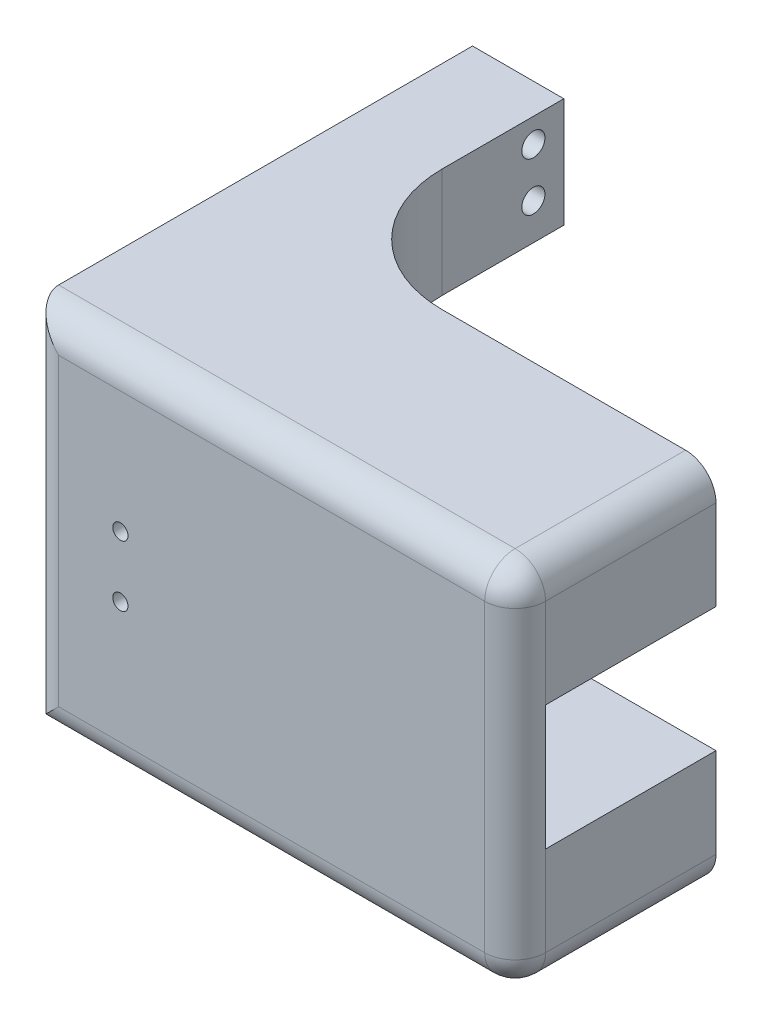
from build123d import *

# Parameters (mm, degrees)
SKETCH_2_W          = 80
SKETCH_2_H          = 60
EXTRUDE_2_DEPTH     = 33
SKETCH_3_W          = 40.7
SKETCH_3_H          = 20.5
CUT_EXTRUDE_1_DEPTH = 28
SKETCH_4_W          = 19.65
SKETCH_4_H          = 20.5
EXTRUDE_3_DEPTH     = 28
SKETCH_5_W          = 19.65
SKETCH_5_H          = 20.5
CUT_EXTRUDE_4_DEPTH = 28
SKETCH_10_W         = 15
SKETCH_10_H         = 18
EXTRUDE_6_DEPTH     = 40
M3X0_5_1_D          = 2.5
FILLET_2_R          = 20
FILLET_START        = -41
FILLET_7_DEPTH      = 81
FILLET_START_2      = -31
FILLET_7_2_DEPTH    = 62
FILLET_8_R          = 5
FILLET_10_R         = 1
M3X0_5_2_D          = 2.5
SKETCH_15_R         = 1.9
CUT_EXTRUDE_7_DEPTH = 65.031242484


with BuildPart() as part:
    # ｽｹｯﾁ2 → ﾎﾞｽ - 押し出し2 (new body)
    with BuildSketch(Plane.XY):
        Rectangle(SKETCH_2_W, SKETCH_2_H)
    extrude(amount=EXTRUDE_2_DEPTH)

    # ｽｹｯﾁ3 → ｶｯﾄ - 押し出し1 (cut)
    with BuildSketch(Plane.XY):
        Rectangle(SKETCH_3_W, SKETCH_3_H)
    extrude(amount=CUT_EXTRUDE_1_DEPTH, mode=Mode.SUBTRACT)

    # ｽｹｯﾁ4 → ﾎﾞｽ - 押し出し3 (add)
    with BuildSketch(Plane.XY):
        with Locations((30.175, 0)):
            Rectangle(SKETCH_4_W, SKETCH_4_H)
    extrude(amount=EXTRUDE_3_DEPTH)

    # ｽｹｯﾁ5 → ｶｯﾄ - 押し出し4 (cut)
    with BuildSketch(Plane.XY):
        with Locations((30.175, 0)):
            Rectangle(SKETCH_5_W, SKETCH_5_H)
    extrude(amount=CUT_EXTRUDE_4_DEPTH, mode=Mode.SUBTRACT)

    # ｽｹｯﾁ10 → ﾎﾞｽ - 押し出し6 (add)
    with BuildSketch(Plane.XY):
        with Locations((-32.5, 21)):
            Rectangle(SKETCH_10_W, SKETCH_10_H)
        with Locations((-32.5, -21)):
            Rectangle(SKETCH_10_W, SKETCH_10_H)
    extrude(amount=-EXTRUDE_6_DEPTH)

    # M3x0.5 ねじ穴1 (through all)
    with Locations(Plane(origin=(-25, 0, 0), x_dir=(0, 0, -1), z_dir=(1, 0, 0))):
        with Locations((35, 18), (35, -18), (35, 26), (35, -26)):
            Hole(M3X0_5_1_D / 2)

    # ﾌｨﾚｯﾄ2
    fillet_2_edges = [part.edges().sort_by_distance(p)[0] for p in [
        (-25, 21, 0),
        (-25, -21, 0),
    ]]
    fillet(fillet_2_edges, radius=FILLET_2_R)

    # ﾌｨﾚｯﾄ7: read off the stored shape, not the designer's step
    # ﾌｨﾚｯﾄ7 outline → ﾌｨﾚｯﾄ7 (cut)
    with BuildSketch(Plane.YZ.offset(FILLET_START)):
        with BuildLine():
            ThreePointArc((-30, 28), (-28.535533906, 31.535533906), (-25, 33))
            Line((-25, 33), (-30, 33))
            Line((-30, 33), (-30, 28))
        make_face()
        with BuildLine():
            ThreePointArc((25, 33), (28.535533906, 31.535533906), (30, 28))
            Line((30, 28), (30, 33))
            Line((30, 33), (25, 33))
        make_face()
    extrude(amount=FILLET_7_DEPTH, mode=Mode.SUBTRACT)

    # Fillet 7 2 outline → Fillet 7 2 (cut)
    with BuildSketch(Plane(origin=(0, 0, 0), x_dir=(1, 0, 0), z_dir=(0, 1, 0)).offset(FILLET_START_2)):
        with BuildLine():
            ThreePointArc((40, -28), (38.535533906, -31.535533906), (35, -33))
            Line((35, -33), (40, -33))
            Line((40, -33), (40, -28))
        make_face()
        with BuildLine():
            ThreePointArc((-35, -33), (-38.535533906, -31.535533906), (-40, -28))
            Line((-40, -28), (-40, -33))
            Line((-40, -33), (-35, -33))
        make_face()
    extrude(amount=FILLET_7_2_DEPTH, mode=Mode.SUBTRACT)

    # ﾌｨﾚｯﾄ8
    # the kernel refuses this fillet: 5 mm, written as the material it takes off along each edge
    with BuildSketch(Plane(origin=(35, 25, 28), x_dir=(1, 0, 0), z_dir=(0, 1, 0))) as fillet_8_piece_1_section:
        Polygon((0, 0), (FILLET_8_R, 0), (FILLET_8_R, -FILLET_8_R), (0, -FILLET_8_R), align=None)
    fillet_8_piece_1 = extrude(amount=FILLET_8_R, mode=Mode.PRIVATE)
    fillet_8_piece_1 = fillet_8_piece_1 - Plane(origin=(35, 25, 28), x_dir=(-0.7071067811865475, 0, -0.7071067811865475), z_dir=(0, 1, 0)) * Sphere(FILLET_8_R, mode=Mode.PRIVATE)
    add(fillet_8_piece_1, mode=Mode.SUBTRACT)
    with BuildSketch(Plane(origin=(35, -25, 28), x_dir=(0, -1, 0), z_dir=(1, 0, 0))) as fillet_8_piece_2_section:
        Polygon((0, 0), (FILLET_8_R, 0), (FILLET_8_R, -FILLET_8_R), (0, -FILLET_8_R), align=None)
    fillet_8_piece_2 = extrude(amount=FILLET_8_R, mode=Mode.PRIVATE)
    fillet_8_piece_2 = fillet_8_piece_2 - Plane(origin=(35, -25, 28), x_dir=(0, 0.7071067811865475, -0.7071067811865475), z_dir=(1, 0, 0)) * Sphere(FILLET_8_R, mode=Mode.PRIVATE)
    add(fillet_8_piece_2, mode=Mode.SUBTRACT)
    with BuildSketch(Plane(origin=(40, -30, -12.5), x_dir=(0, 1, 0), z_dir=(0, 0, 1)), Plane(origin=(40, 30, -12.5), x_dir=(-1, 0, 0), z_dir=(0, 0, 1))) as fillet_8_piece_3:
        with BuildLine():
            CenterArc((FILLET_8_R, FILLET_8_R), FILLET_8_R, 180, 90)
            Line((0, FILLET_8_R), (0, 0))
            Line((0, 0), (FILLET_8_R, 0))
        make_face()
    extrude(amount=40.5, mode=Mode.SUBTRACT)

    # ﾌｨﾚｯﾄ10
    fillet_10_edges = [part.edges().sort_by_distance(p)[0] for p in [
        (-22.5, 12, 0),
        (-22.5, -12, 0),
    ]]
    fillet(fillet_10_edges, radius=FILLET_10_R)

    # M3x0.5 ねじ穴2 (through all)
    with Locations(Plane(origin=(0, 0, 0), x_dir=(-1, 0, 0), z_dir=(0, 0, -1))):
        with Locations((24.85, 5), (24.85, -5)):
            Hole(M3X0_5_2_D / 2)

    # ｽｹｯﾁ15 → ｶｯﾄ - 押し出し7 (cut, through all)
    with BuildSketch(Plane(origin=(0, 0, 0), x_dir=(0, 0, -1), z_dir=(1, 0, 0))):
        with Locations((35, 26)):
            Circle(SKETCH_15_R)
        with Locations((35, 18)):
            Circle(SKETCH_15_R)
        with Locations((35, -18)):
            Circle(SKETCH_15_R)
        with Locations((35, -26)):
            Circle(SKETCH_15_R)
    extrude(amount=-CUT_EXTRUDE_7_DEPTH, mode=Mode.SUBTRACT)


solid = part.part
